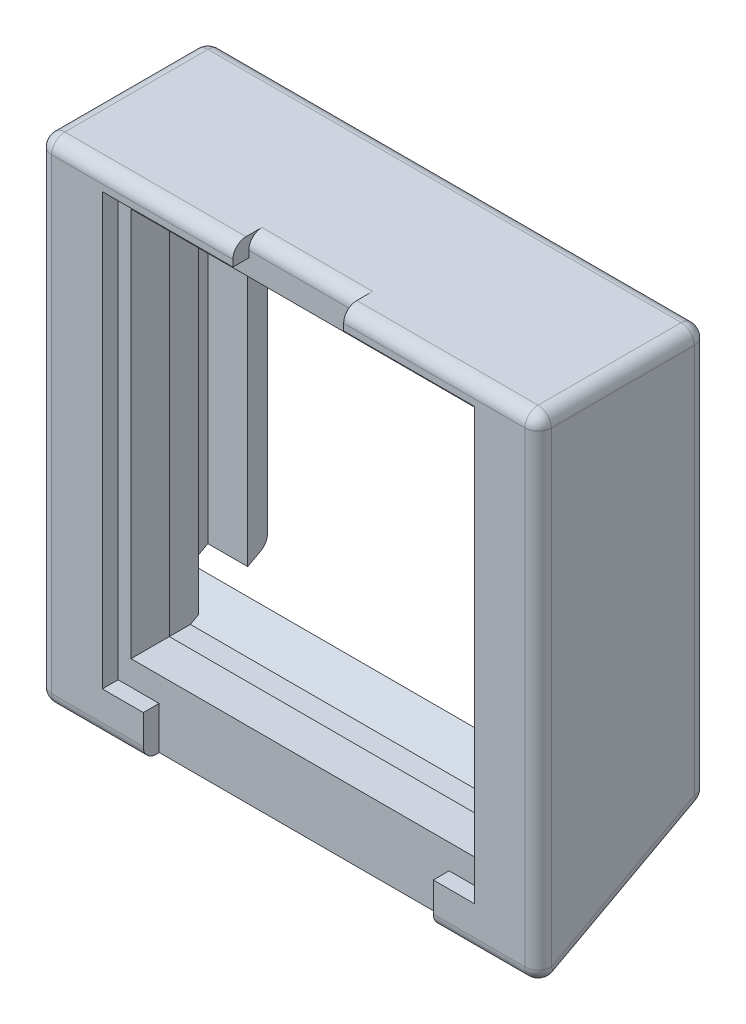
from build123d import *

# Parameters (mm, degrees)
BOSS_EXTRUDE1_START    = -18.95
BOSS_EXTRUDE1_DEPTH    = 4.52
BOSS_EXTRUDE1_START_2  = -14.43
BOSS_EXTRUDE1_2_DEPTH  = 1.3
BOSS_EXTRUDE1_3_DEPTH  = 1.5
BOSS_EXTRUDE1_4_DEPTH  = 0.3
BOSS_EXTRUDE1_START_3  = -14.13
BOSS_EXTRUDE1_5_DEPTH  = 0.02
BOSS_EXTRUDE1_START_4  = 14.43
BOSS_EXTRUDE1_6_DEPTH  = 4.52
BOSS_EXTRUDE1_START_5  = 13.13
BOSS_EXTRUDE1_7_DEPTH  = 1.3
BOSS_EXTRUDE1_START_6  = 17.45
BOSS_EXTRUDE1_8_DEPTH  = 1.5
BOSS_EXTRUDE1_START_7  = 14.13
BOSS_EXTRUDE1_9_DEPTH  = 0.3
BOSS_EXTRUDE1_START_8  = 14.11
BOSS_EXTRUDE1_10_DEPTH = 0.02
BOSS_EXTRUDE2_START    = -17.45
BOSS_EXTRUDE2_DEPTH    = 34.9
FILLET1_R              = 1
SKETCH5_W              = 22
SKETCH5_H              = 3.243209614
CUT_EXTRUDE1_DEPTH     = 1.2
CHAMFER1_SIZE          = 0.7
FILLET2_R              = 1


# Read off the part's stored shape, not the designer's step: Boss-Extrude1
with BuildPart() as part:
    # Boss-Extrude1 outline → Boss-Extrude1 (new body)
    with BuildSketch(Plane.YZ.offset(BOSS_EXTRUDE1_START)):
        Polygon((-5.831945908, -1.7), (25.335, -1.7), (25.335, -0.2), (-6.639803051, -0.2), align=None)
        Polygon((-7.74387448, 1.85), (25.335, 1.85), (25.335, 11.15), (-12.752588765, 11.15), align=None)
    extrude(amount=BOSS_EXTRUDE1_DEPTH)

    # Boss-Extrude1 2 outline → Boss-Extrude1 2 (add)
    with BuildSketch(Plane.YZ.offset(BOSS_EXTRUDE1_START_2)):
        Polygon((-10.167445908, 6.35), (25.335, 6.35), (25.335, 9.95), (-12.106303051, 9.95), align=None)
    extrude(amount=BOSS_EXTRUDE1_2_DEPTH)

    # Boss-Extrude1 3 outline → Boss-Extrude1 3 (add)
    with BuildSketch(Plane.YZ.offset(BOSS_EXTRUDE1_START)):
        Polygon((-6.639803051, -0.2), (25.335, -0.2), (25.335, 1.85), (-7.74387448, 1.85), align=None)
    extrude(amount=BOSS_EXTRUDE1_3_DEPTH)

    # Boss-Extrude1 4 outline → Boss-Extrude1 4 (add)
    with BuildSketch(Plane.YZ.offset(BOSS_EXTRUDE1_START_2)):
        Polygon((-7.74387448, 1.85), (25.335, 1.85), (25.335, 6.35), (-10.167445908, 6.35), align=None)
        Polygon((-12.106303051, 9.95), (25.335, 9.95), (25.335, 11.15), (-12.752588765, 11.15), align=None)
    extrude(amount=BOSS_EXTRUDE1_4_DEPTH)

    # Boss-Extrude1 5 outline → Boss-Extrude1 5 (add)
    with BuildSketch(Plane.YZ.offset(BOSS_EXTRUDE1_START_3)):
        Polygon((-12.106303051, 9.95), (25.335, 9.95), (25.335, 11.15), (-12.752588765, 11.15), align=None)
    extrude(amount=BOSS_EXTRUDE1_5_DEPTH)



with BuildPart() as body_2:
    # Boss-Extrude1 6 outline → Boss-Extrude1 6 (new body)
    with BuildSketch(Plane.YZ.offset(BOSS_EXTRUDE1_START_4)):
        Polygon((-5.831945908, -1.7), (25.335, -1.7), (25.335, -0.2), (-6.639803051, -0.2), align=None)
        Polygon((-7.74387448, 1.85), (25.335, 1.85), (25.335, 11.15), (-12.752588765, 11.15), align=None)
    extrude(amount=BOSS_EXTRUDE1_6_DEPTH)

    # Boss-Extrude1 7 outline → Boss-Extrude1 7 (add)
    with BuildSketch(Plane.YZ.offset(BOSS_EXTRUDE1_START_5)):
        Polygon((-10.167445908, 6.35), (25.335, 6.35), (25.335, 9.95), (-12.106303051, 9.95), align=None)
    extrude(amount=BOSS_EXTRUDE1_7_DEPTH)

    # Boss-Extrude1 8 outline → Boss-Extrude1 8 (add)
    with BuildSketch(Plane.YZ.offset(BOSS_EXTRUDE1_START_6)):
        Polygon((-6.639803051, -0.2), (25.335, -0.2), (25.335, 1.85), (-7.74387448, 1.85), align=None)
    extrude(amount=BOSS_EXTRUDE1_8_DEPTH)

    # Boss-Extrude1 9 outline → Boss-Extrude1 9 (add)
    with BuildSketch(Plane.YZ.offset(BOSS_EXTRUDE1_START_7)):
        Polygon((-7.74387448, 1.85), (25.335, 1.85), (25.335, 6.35), (-10.167445908, 6.35), align=None)
        Polygon((-12.106303051, 9.95), (25.335, 9.95), (25.335, 11.15), (-12.752588765, 11.15), align=None)
    extrude(amount=BOSS_EXTRUDE1_9_DEPTH)

    # Boss-Extrude1 10 outline → Boss-Extrude1 10 (add)
    with BuildSketch(Plane.YZ.offset(BOSS_EXTRUDE1_START_8)):
        Polygon((-12.106303051, 9.95), (25.335, 9.95), (25.335, 11.15), (-12.752588765, 11.15), align=None)
    extrude(amount=BOSS_EXTRUDE1_10_DEPTH)


with BuildPart() as part_1:
    add(part.part)

    add(body_2.part)  # Boss-Extrude2 merges body 2
    # Sketch4 → Boss-Extrude2 (add)
    with BuildSketch(Plane(origin=(0, 0, 0), x_dir=(0, 0, -1), z_dir=(1, 0, 0)).offset(BOSS_EXTRUDE2_START)):
        Polygon((1.7, 25.335), (-11.15, 25.335), (-11.15, 23.835), (-9.95, 23.835), (-9.95, 22.59), (-6.35, 22.59), (-6.35, 23.59), (-1.85, 23.59), (-1.85, 23.835), (1.7, 23.835), align=None)
        Polygon((-11.15, -8.835), (-11.15, -12.752588765), (-1.85, -7.74387448), (-1.85, -6.559714286), (-4.45, -7.96), (-6.35, -7.96), (-6.35, -6.96), (-9.95, -6.96), (-9.95, -8.835), align=None)
    extrude(amount=BOSS_EXTRUDE2_DEPTH)

    # Fillet1
    # the kernel refuses this fillet: 1 mm, written as the material it takes off along each edge
    with BuildSketch(Plane(origin=(-14.13, -7.74387448, 1.85), x_dir=(0, -0.47417482524162685, 0.8804307099977104), z_dir=(1, 0, 0))) as fillet1_piece_1:
        with BuildLine():
            CenterArc((FILLET1_R * 0.597236294449, -FILLET1_R), FILLET1_R, 90, 61.694363428)
            Line((-FILLET1_R * 0.283194415548, -FILLET1_R * 0.525825174758), (0, 0))
            Line((0, 0), (FILLET1_R * 0.597236294449, 0))
        make_face()
    extrude(amount=28.26, mode=Mode.SUBTRACT)
    with BuildSketch(Plane(origin=(-14.11, -12.752588765, 11.15), x_dir=(0, 0.47417482524162624, -0.8804307099977108), z_dir=(1, 0, 0))) as fillet1_piece_2:
        with BuildLine():
            CenterArc((FILLET1_R * 1.67437915159, FILLET1_R), FILLET1_R, 151.694363428, 118.305636572)
            Line((FILLET1_R * 0.793948441594, FILLET1_R * 1.47417482524), (0, 0))
            Line((0, 0), (FILLET1_R * 1.67437915159, 0))
        make_face()
    extrude(amount=28.22, mode=Mode.SUBTRACT)
    with BuildSketch(Plane(origin=(-14.43, -12.752588765, 11.15), x_dir=(0, 0.4741748250791318, -0.8804307100852257), z_dir=(1, 0, 0)), Plane(origin=(14.11, -12.752588765, 11.15), x_dir=(0, 0.4741748250791318, -0.8804307100852257), z_dir=(1, 0, 0))) as fillet1_piece_3:
        with BuildLine():
            CenterArc((FILLET1_R * 1.67437915124, FILLET1_R), FILLET1_R, 151.694363439, 118.305636561)
            Line((FILLET1_R * 0.793948441156, FILLET1_R * 1.47417482508), (0, 0))
            Line((0, 0), (FILLET1_R * 1.67437915124, 0))
        make_face()
    extrude(amount=0.32, mode=Mode.SUBTRACT)
    with BuildSketch(Plane(origin=(14.43, -12.752588765, 11.15), x_dir=(0, 0.4741748251892074, -0.8804307100259421), z_dir=(1, 0, 0)), Plane(origin=(-23.135947879, -12.752588765, 11.15), x_dir=(0, 0.4741748251892074, -0.8804307100259421), z_dir=(1, 0, 0))) as fillet1_piece_4:
        with BuildLine():
            CenterArc((FILLET1_R * 1.67437915148, FILLET1_R), FILLET1_R, 151.694363432, 118.305636568)
            Line((FILLET1_R * 0.793948441453, FILLET1_R * 1.47417482519), (0, 0))
            Line((0, 0), (FILLET1_R * 1.67437915148, 0))
        make_face()
    extrude(amount=8.705947879, mode=Mode.SUBTRACT)
    with BuildSketch(Plane(origin=(-14.43, -7.74387448, 1.85), x_dir=(0, -0.47417482515496245, 0.8804307100443854), z_dir=(1, 0, 0)), Plane(origin=(14.13, -7.74387448, 1.85), x_dir=(0, -0.47417482515496245, 0.8804307100443854), z_dir=(1, 0, 0))) as fillet1_piece_5:
        with BuildLine():
            CenterArc((FILLET1_R * 0.597236294516, -FILLET1_R), FILLET1_R, 90, 61.694363434)
            Line((-FILLET1_R * 0.283194415528, -FILLET1_R * 0.525825174845), (0, 0))
            Line((0, 0), (FILLET1_R * 0.597236294516, 0))
        make_face()
    extrude(amount=0.3, mode=Mode.SUBTRACT)
    with BuildSketch(Plane(origin=(14.43, -7.74387448, 1.85), x_dir=(0, 1, 0), z_dir=(1, 0, 0))) as fillet1_piece_6:
        with BuildLine():
            CenterArc((FILLET1_R * 0.59723629449, FILLET1_R), FILLET1_R, 208.305636568, 61.694363432)
            Line((-FILLET1_R * 0.283194415536, FILLET1_R * 0.525825174811), (0, 0))
            Line((0, 0), (FILLET1_R * 0.59723629449, 0))
        make_face()
    extrude(amount=3.02, mode=Mode.SUBTRACT)
    with BuildSketch(Plane(origin=(-17.45, -7.74387448, 1.85), x_dir=(0, -0.4741748251892074, 0.8804307100259422), z_dir=(1, 0, 0))) as fillet1_piece_7:
        with BuildLine():
            CenterArc((FILLET1_R * 0.59723629449, -FILLET1_R), FILLET1_R, 90, 61.694363432)
            Line((-FILLET1_R * 0.283194415536, -FILLET1_R * 0.525825174811), (0, 0))
            Line((0, 0), (FILLET1_R * 0.59723629449, 0))
        make_face()
    extrude(amount=3.02, mode=Mode.SUBTRACT)

    # Sketch5 → Cut-Extrude1 (cut)
    with BuildSketch(Plane.XY.offset(11.15)):
        Polygon((4.2, 23.635), (4.2, 24.135), (4.2, 25.335), (-4.2, 25.335), (-4.2, 24.135), (-4.2, 23.635), align=None)
        with Locations((0, -10.456604807)):
            Rectangle(SKETCH5_W, SKETCH5_H)
    extrude(amount=-CUT_EXTRUDE1_DEPTH, mode=Mode.SUBTRACT)

    # Chamfer1
    chamfer1_edges = [part_1.edges().sort_by_distance(p)[0] for p in [
        (0, 22.59, 6.35),
        (13.13, 7.815, 6.35),
        (0, -6.96, 6.35),
        (-13.13, 7.815, 6.35),
    ]]
    chamfer(chamfer1_edges, length=CHAMFER1_SIZE)

    # Chamfer2
    # the kernel refuses this chamfer: 2 mm, written as the material it takes off along each edge
    with BuildSketch(Plane(origin=(-14.13, 23.59, 1.85), x_dir=(0, -0.02749587661058563, 0.9996219169112968), z_dir=(1, 0, 0))) as chamfer2_piece_1_section:
        with BuildLine():
            Line((2.05734639, 0), (-0.11309431, -2.054235587))
            Line((-0.11309431, -2.054235587), (-0.153079186, -2.053135752))
            ThreePointArc((-0.153079186, -2.053135752), (-0.068258454, -1.026795659), (-0.039984877, 0.001099835))
            Line((-0.039984877, 0.001099835), (0.001099835, 0.039984877))
            ThreePointArc((0.001099835, 0.039984877), (1.028995329, 0.011711299), (2.058446225, 0.039984877))
            Line((2.058446225, 0.039984877), (2.05734639, 0))
        make_face()
    chamfer2_piece_1 = extrude(amount=28.26, mode=Mode.PRIVATE)
    chamfer2_piece_1 = split(chamfer2_piece_1, bisect_by=Plane(origin=(0, 23.835, 2.821035837), z_dir=(0, -1, 0)), keep=Keep.TOP, mode=Mode.PRIVATE)
    add(chamfer2_piece_1, mode=Mode.SUBTRACT)
    with BuildSketch(Plane(origin=(14.13, -11.703080262, 1.85), x_dir=(-0.027495876610586494, 0, 0.9996219169112968), z_dir=(0, 1, 0))) as chamfer2_piece_2_section:
        with BuildLine():
            Line((2.05734639, 0), (-0.11309431, 2.054235587))
            Line((-0.11309431, 2.054235587), (-0.153079186, 2.053135752))
            ThreePointArc((-0.153079186, 2.053135752), (-0.068258454, 1.026795659), (-0.039984877, -0.001099835))
            Line((-0.039984877, -0.001099835), (0.001099835, -0.039984877))
            ThreePointArc((0.001099835, -0.039984877), (1.028995329, -0.011711299), (2.058446225, -0.039984877))
            Line((2.058446225, -0.039984877), (2.05734639, 0))
        make_face()
    chamfer2_piece_2 = extrude(amount=35.293080262, mode=Mode.PRIVATE)
    chamfer2_piece_2 = split(chamfer2_piece_2, bisect_by=Plane(origin=(14.787189765, -3.487699586, -3.854006073), z_dir=(0, 0.880430709997711, 0.4741748252416259)), keep=Keep.TOP, mode=Mode.PRIVATE)
    add(chamfer2_piece_2, mode=Mode.SUBTRACT)
    with BuildSketch(Plane(origin=(-14.13, -11.703080262, 1.85), x_dir=(0.027495876610586494, 0, 0.9996219169112968), z_dir=(0, 1, 0))) as chamfer2_piece_3_section:
        with BuildLine():
            Line((2.05734639, 0), (-0.11309431, -2.054235587))
            Line((-0.11309431, -2.054235587), (-0.153079186, -2.053135752))
            ThreePointArc((-0.153079186, -2.053135752), (-0.068258454, -1.026795659), (-0.039984877, 0.001099835))
            Line((-0.039984877, 0.001099835), (0.001099835, 0.039984877))
            ThreePointArc((0.001099835, 0.039984877), (1.028995329, 0.011711299), (2.058446225, 0.039984877))
            Line((2.058446225, 0.039984877), (2.05734639, 0))
        make_face()
    chamfer2_piece_3 = extrude(amount=35.293080262, mode=Mode.PRIVATE)
    chamfer2_piece_3 = split(chamfer2_piece_3, bisect_by=Plane(origin=(-14.787189765, -3.487699586, -3.854006073), z_dir=(0, 0.880430709997711, 0.4741748252416259)), keep=Keep.TOP, mode=Mode.PRIVATE)
    add(chamfer2_piece_3, mode=Mode.SUBTRACT)
    with BuildSketch(Plane(origin=(-19.273365976, 23.59, 1.85), x_dir=(0, -0.02749587661058563, 0.9996219169112968), z_dir=(1, 0, 0))) as chamfer2_piece_4a_section:
        with BuildLine():
            Line((2.05734639, 0), (-0.11309431, -2.054235587))
            Line((-0.11309431, -2.054235587), (-0.153079186, -2.053135752))
            ThreePointArc((-0.153079186, -2.053135752), (-0.068258454, -1.026795659), (-0.039984877, 0.001099835))
            Line((-0.039984877, 0.001099835), (0.001099835, 0.039984877))
            ThreePointArc((0.001099835, 0.039984877), (1.028995329, 0.011711299), (2.058446225, 0.039984877))
            Line((2.058446225, 0.039984877), (2.05734639, 0))
        make_face()
    chamfer2_piece_4a = extrude(amount=33.403365976, mode=Mode.PRIVATE)
    chamfer2_piece_4a = split(chamfer2_piece_4a, bisect_by=Plane(origin=(-14.13, 23.683647422, 2.821035837), z_dir=(-1, 0, 0)), keep=Keep.TOP, mode=Mode.PRIVATE)
    chamfer2_piece_4a = split(chamfer2_piece_4a, bisect_by=Plane(origin=(-17.45, 23.683647422, 2.821035837), z_dir=(1, 0, 0)), keep=Keep.TOP, mode=Mode.PRIVATE)
    chamfer2_piece_4a = split(chamfer2_piece_4a, bisect_by=Plane(origin=(-15.79, 23.835, 2.821035837), z_dir=(0, -1, 0)), keep=Keep.TOP, mode=Mode.PRIVATE)
    with BuildSketch(Plane(origin=(-14.13, -11.703080262, 1.85), x_dir=(0.027495876610586494, 0, 0.9996219169112968), z_dir=(0, 1, 0))) as chamfer2_piece_4b_section:
        with BuildLine():
            Line((2.05734639, 0), (-0.11309431, -2.054235587))
            Line((-0.11309431, -2.054235587), (-0.153079186, -2.053135752))
            ThreePointArc((-0.153079186, -2.053135752), (-0.068258454, -1.026795659), (-0.039984877, 0.001099835))
            Line((-0.039984877, 0.001099835), (0.001099835, 0.039984877))
            ThreePointArc((0.001099835, 0.039984877), (1.028995329, 0.011711299), (2.058446225, 0.039984877))
            Line((2.058446225, 0.039984877), (2.05734639, 0))
        make_face()
    chamfer2_piece_4b = extrude(amount=40.436446238, mode=Mode.PRIVATE)
    chamfer2_piece_4b = split(chamfer2_piece_4b, bisect_by=Plane(origin=(-14.789587254, 23.59, 2.509587254), z_dir=(0, 1, 0)), keep=Keep.TOP, mode=Mode.PRIVATE)
    chamfer2_piece_4b = split(chamfer2_piece_4b, bisect_by=Plane(origin=(-14.789587254, 23.835, 2.509587254), z_dir=(0, -1, 0)), keep=Keep.TOP, mode=Mode.PRIVATE)
    chamfer2_piece_4 = chamfer2_piece_4a & chamfer2_piece_4b
    add(chamfer2_piece_4, mode=Mode.SUBTRACT)
    with BuildSketch(Plane(origin=(-14.13, 23.59, 1.85), x_dir=(0, -0.02749587661058563, 0.9996219169112968), z_dir=(1, 0, 0))) as chamfer2_piece_5a_section:
        with BuildLine():
            Line((2.05734639, 0), (-0.11309431, -2.054235587))
            Line((-0.11309431, -2.054235587), (-0.153079186, -2.053135752))
            ThreePointArc((-0.153079186, -2.053135752), (-0.068258454, -1.026795659), (-0.039984877, 0.001099835))
            Line((-0.039984877, 0.001099835), (0.001099835, 0.039984877))
            ThreePointArc((0.001099835, 0.039984877), (1.028995329, 0.011711299), (2.058446225, 0.039984877))
            Line((2.058446225, 0.039984877), (2.05734639, 0))
        make_face()
    chamfer2_piece_5a = extrude(amount=33.403365976, mode=Mode.PRIVATE)
    chamfer2_piece_5a = split(chamfer2_piece_5a, bisect_by=Plane(origin=(14.13, 23.683647422, 2.821035837), z_dir=(1, 0, 0)), keep=Keep.TOP, mode=Mode.PRIVATE)
    chamfer2_piece_5a = split(chamfer2_piece_5a, bisect_by=Plane(origin=(15.79, 23.835, 2.821035837), z_dir=(0, -1, 0)), keep=Keep.TOP, mode=Mode.PRIVATE)
    chamfer2_piece_5a = split(chamfer2_piece_5a, bisect_by=Plane(origin=(17.45, 23.683647422, 2.821035837), z_dir=(-1, 0, 0)), keep=Keep.TOP, mode=Mode.PRIVATE)
    with BuildSketch(Plane(origin=(14.13, -11.703080262, 1.85), x_dir=(-0.027495876610586494, 0, 0.9996219169112968), z_dir=(0, 1, 0))) as chamfer2_piece_5b_section:
        with BuildLine():
            Line((2.05734639, 0), (-0.11309431, 2.054235587))
            Line((-0.11309431, 2.054235587), (-0.153079186, 2.053135752))
            ThreePointArc((-0.153079186, 2.053135752), (-0.068258454, 1.026795659), (-0.039984877, -0.001099835))
            Line((-0.039984877, -0.001099835), (0.001099835, -0.039984877))
            ThreePointArc((0.001099835, -0.039984877), (1.028995329, -0.011711299), (2.058446225, -0.039984877))
            Line((2.058446225, -0.039984877), (2.05734639, 0))
        make_face()
    chamfer2_piece_5b = extrude(amount=40.436446238, mode=Mode.PRIVATE)
    chamfer2_piece_5b = split(chamfer2_piece_5b, bisect_by=Plane(origin=(14.789587254, 23.59, 2.509587254), z_dir=(0, 1, 0)), keep=Keep.TOP, mode=Mode.PRIVATE)
    chamfer2_piece_5b = split(chamfer2_piece_5b, bisect_by=Plane(origin=(14.789587254, 23.835, 2.509587254), z_dir=(0, -1, 0)), keep=Keep.TOP, mode=Mode.PRIVATE)
    chamfer2_piece_5 = chamfer2_piece_5a & chamfer2_piece_5b
    add(chamfer2_piece_5, mode=Mode.SUBTRACT)

    # Fillet2
    fillet2_edges = [part_1.edges().sort_by_distance(p)[0] for p in [
        (18.95, -9.851257402, 5.762912587),
        (16.69, -5.831945908, -1.7),
        (-18.95, 7.128395193, 11.15),
        (-18.95, -9.851257402, 5.762912587),
        (-18.95, -11.936747564, 10.662750024),
        (18.95, 7.128395193, 11.15),
        (18.95, -11.936747564, 10.662750024),
        (11.575, 25.335, 11.15),
        (-16.69, -5.831945908, -1.7),
        (0, 25.335, 9.95),
        (0, 25.335, -1.7),
        (-18.95, 25.335, 4.725),
        (-11.575, 25.335, 11.15),
        (18.95, 25.335, 4.725),
        (18.95, 9.751527046, -1.7),
        (-18.95, 9.751527046, -1.7),
    ]]
    fillet(fillet2_edges, radius=FILLET2_R)


solid = part_1.part
